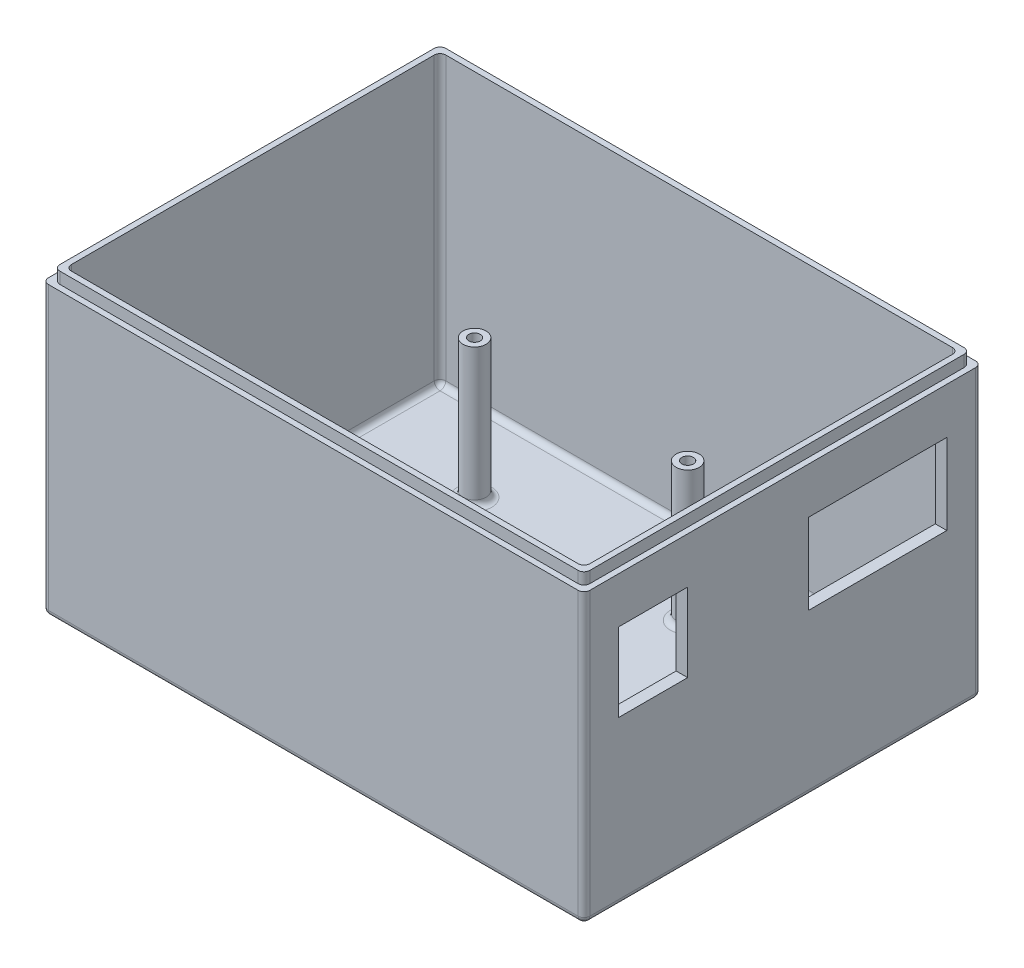
from build123d import *

# Parameters (mm, degrees)
SKETCH1_W            = 90
SKETCH1_H            = 65
BOSS_EXTRUDE1_DEPTH  = 50
SHELL1_T             = 2
SKETCH2_R            = 2.5
BOSS_EXTRUDE2_DEPTH  = 10
SKETCH3_R            = 2.5
SKETCH3_R_2          = 2.67280604
BOSS_EXTRUDE3_DEPTH  = 4
SKETCH5_R            = 1
CUT_EXTRUDE1_DEPTH   = 3
SKETCH7_R            = 2
BOSS_EXTRUDE5_DEPTH  = 24
SKETCH11_R           = 1
CUT_EXTRUDE2_DEPTH   = 4
SKETCH12_W           = 24
SKETCH12_H           = 14
SKETCH12_W_2         = 12
SKETCH12_H_2         = 13.621990599
CUT_EXTRUDE3_DEPTH   = 4
SKETCH13_OUTSIDE_W   = 121.536
SKETCH13_OUTSIDE_H   = 96.536
SKETCH13_OUTSIDE_W_2 = 92
SKETCH13_OUTSIDE_H_2 = 67
CUT_EXTRUDE4_DEPTH   = 2
FILLET1_R            = 1
FILLET2_R            = 1
FILLET3_R            = 1
FILLET4_R            = 1
FILLET5_R            = 1
FILLET6_R            = 1
FILLET7_R            = 1
SKETCH15_R           = 1.25
CUT_EXTRUDE5_DEPTH   = 71.705374619


with BuildPart() as part:
    # Sketch1 → Boss-Extrude1 (new body)
    with BuildSketch(Plane(origin=(0, 0, 0), x_dir=(1, 0, 0), z_dir=(0, 1, 0))):
        Rectangle(SKETCH1_W, SKETCH1_H)
    extrude(amount=BOSS_EXTRUDE1_DEPTH)

    # Shell1
    shell1_openings = [part.faces().sort_by_distance(p)[0] for p in [
        (0, 50, 0),
    ]]
    offset(amount=SHELL1_T, openings=shell1_openings, kind=Kind.INTERSECTION)

    # Sketch2 → Boss-Extrude2 (add)
    with BuildSketch(Plane(origin=(0, 0, 0), x_dir=(1, 0, 0), z_dir=(0, 1, 0))):
        with Locations(Location((40, 0, 0), (0, 0, 270))):
            Circle(SKETCH2_R)
        with Locations(Location((-40, 0, 0), (0, 0, 90))):
            Circle(SKETCH2_R)
    extrude(amount=BOSS_EXTRUDE2_DEPTH)

    # Sketch3 → Boss-Extrude3 (add)
    with BuildSketch(Plane(origin=(0, 0, 0), x_dir=(1, 0, 0), z_dir=(0, 1, 0))):
        with Locations(Location((40, 27.5, 0), (0, 0, 270))):
            Circle(SKETCH3_R)
        with Locations(Location((-40, -27.5, 0), (0, 0, 270))):
            Circle(SKETCH3_R_2)
    extrude(amount=BOSS_EXTRUDE3_DEPTH)

    # Sketch5 → Cut-Extrude1 (cut)
    with BuildSketch(Plane(origin=(0, 4, 0), x_dir=(1, 0, 0), z_dir=(0, 1, 0))):
        with Locations(Location((40, 27.5, 0), (0, 0, 270))):
            Circle(SKETCH5_R)
        with Locations(Location((-40, -27.5, 0), (0, 0, 270))):
            Circle(SKETCH5_R)
    extrude(amount=-CUT_EXTRUDE1_DEPTH, mode=Mode.SUBTRACT)

    # Sketch7 → Boss-Extrude5 (add)
    with BuildSketch(Plane(origin=(0, 0, 0), x_dir=(1, 0, 0), z_dir=(0, 1, 0))):
        with Locations(Location((-25, -18.5, 0), (0, 0, 270))):
            Circle(SKETCH7_R)
        with Locations(Location((-25, 18.5, 0), (0, 0, 90))):
            Circle(SKETCH7_R)
        with Locations(Location((12, 18.5, 0), (0, 0, 270))):
            Circle(SKETCH7_R)
        with Locations(Location((12, -18.5, 0), (0, 0, 90))):
            Circle(SKETCH7_R)
    extrude(amount=BOSS_EXTRUDE5_DEPTH)

    # Sketch11 → Cut-Extrude2 (cut)
    with BuildSketch(Plane(origin=(0, 24, 0), x_dir=(1, 0, 0), z_dir=(0, 1, 0))):
        with Locations(Location((12, 18.5, 0), (0, 0, 270))):
            Circle(SKETCH11_R)
        with Locations(Location((-25, 18.5, 0), (0, 0, 270))):
            Circle(SKETCH11_R)
        with Locations(Location((-25, -18.5, 0), (0, 0, 270))):
            Circle(SKETCH11_R)
        with Locations(Location((12, -18.5, 0), (0, 0, 270))):
            Circle(SKETCH11_R)
    extrude(amount=-CUT_EXTRUDE2_DEPTH, mode=Mode.SUBTRACT)

    # Sketch12 → Cut-Extrude3 (cut)
    with BuildSketch(Plane(origin=(47, 0, 0), x_dir=(0, 0, -1), z_dir=(1, 0, 0))):
        with Locations((16.5, 33)):
            Rectangle(SKETCH12_W, SKETCH12_H)
        with Locations((-22.5, 33.1890047)):
            Rectangle(SKETCH12_W_2, SKETCH12_H_2)
    extrude(amount=-CUT_EXTRUDE3_DEPTH, mode=Mode.SUBTRACT)

    # Sketch13 outside → Cut-Extrude4 (cut)
    with BuildSketch(Plane(origin=(0, 50, 0), x_dir=(1, 0, 0), z_dir=(0, 1, 0))):
        Rectangle(SKETCH13_OUTSIDE_W, SKETCH13_OUTSIDE_H)
        Rectangle(SKETCH13_OUTSIDE_W_2, SKETCH13_OUTSIDE_H_2, mode=Mode.SUBTRACT)
    extrude(amount=-CUT_EXTRUDE4_DEPTH, mode=Mode.SUBTRACT)

    # Fillet1
    fillet1_edges = [part.edges().sort_by_distance(p)[0] for p in [
        (-45, 0, 0),
        (0, 0, 32.5),
        (45, 0, 0),
        (0, 0, -32.5),
    ]]
    fillet(fillet1_edges, radius=FILLET1_R)

    # Fillet2
    # the kernel refuses this fillet: 1 mm, written as the material it adds along each edge
    with BuildSketch(Plane(origin=(44, 1, 31.5), x_dir=(1, 0, 0), z_dir=(0, 0, 1))) as fillet2_piece_1_section:
        Polygon((0, 0), (FILLET2_R, 0), (FILLET2_R, -FILLET2_R), (0, -FILLET2_R), align=None)
    fillet2_piece_1 = extrude(amount=FILLET2_R, mode=Mode.PRIVATE)
    fillet2_piece_1 = fillet2_piece_1 - Plane(origin=(44, 1, 31.5), x_dir=(-0.7071067811865475, 0.7071067811865475, 0), z_dir=(0, 0, 1)) * Sphere(FILLET2_R, mode=Mode.PRIVATE)
    add(fillet2_piece_1)
    with BuildSketch(Plane(origin=(-44, 1, 31.5), x_dir=(-1, 0, 0), z_dir=(0, 0, 1))) as fillet2_piece_2_section:
        Polygon((0, 0), (FILLET2_R, 0), (FILLET2_R, FILLET2_R), (0, FILLET2_R), align=None)
    fillet2_piece_2 = extrude(amount=FILLET2_R, mode=Mode.PRIVATE)
    fillet2_piece_2 = fillet2_piece_2 - Plane(origin=(-44, 1, 31.5), x_dir=(0.7071067811865475, 0.7071067811865475, 0), z_dir=(0, 0, 1)) * Sphere(FILLET2_R, mode=Mode.PRIVATE)
    add(fillet2_piece_2)
    with BuildSketch(Plane(origin=(44, 1, -31.5), x_dir=(0, 0, -1), z_dir=(1, 0, 0))) as fillet2_piece_3_section:
        Polygon((0, 0), (FILLET2_R, 0), (FILLET2_R, -FILLET2_R), (0, -FILLET2_R), align=None)
    fillet2_piece_3 = extrude(amount=FILLET2_R, mode=Mode.PRIVATE)
    fillet2_piece_3 = fillet2_piece_3 - Plane(origin=(44, 1, -31.5), x_dir=(0, 0.7071067811865475, 0.7071067811865475), z_dir=(1, 0, 0)) * Sphere(FILLET2_R, mode=Mode.PRIVATE)
    add(fillet2_piece_3)
    with BuildSketch(Plane(origin=(-44, 1, -31.5), x_dir=(0, 0, -1), z_dir=(-1, 0, 0))) as fillet2_piece_4_section:
        Polygon((0, 0), (FILLET2_R, 0), (FILLET2_R, FILLET2_R), (0, FILLET2_R), align=None)
    fillet2_piece_4 = extrude(amount=FILLET2_R, mode=Mode.PRIVATE)
    fillet2_piece_4 = fillet2_piece_4 - Plane(origin=(-44, 1, -31.5), x_dir=(0, 0.7071067811865475, 0.7071067811865475), z_dir=(-1, 0, 0)) * Sphere(FILLET2_R, mode=Mode.PRIVATE)
    add(fillet2_piece_4)
    with BuildSketch(Plane(origin=(-45, 1, -32.5), x_dir=(0, 0, 1), z_dir=(0, 1, 0)), Plane(origin=(-45, 1, 32.5), x_dir=(1, 0, 0), z_dir=(0, 1, 0))) as fillet2_piece_5:
        with BuildLine():
            CenterArc((FILLET2_R, FILLET2_R), FILLET2_R, 180, 90)
            Line((0, FILLET2_R), (0, 0))
            Line((0, 0), (FILLET2_R, 0))
        make_face()
    extrude(amount=49)
    with BuildSketch(Plane(origin=(45, 1, 32.5), x_dir=(-1, 0, 0), z_dir=(0, 1, 0)), Plane(origin=(45, 1, -32.5), x_dir=(0, 0, 1), z_dir=(0, 1, 0))) as fillet2_piece_6:
        with BuildLine():
            CenterArc((FILLET2_R, -FILLET2_R), FILLET2_R, 90, 90)
            Line((0, -FILLET2_R), (0, 0))
            Line((0, 0), (FILLET2_R, 0))
        make_face()
    extrude(amount=49)

    # Fillet3
    fillet3_edges = [part.edges().sort_by_distance(p)[0] for p in [
        (40, 0, -2.5),
        (-40, 0, 2.5),
        (40, 0, -30),
        (-40, 0, 24.82719396),
        (12, 0, -20.5),
        (-25, 0, 16.5),
        (-25, 0, -16.5),
        (12, 0, 20.5),
    ]]
    fillet(fillet3_edges, radius=FILLET3_R)

    # Fillet4
    fillet4_edges = [part.edges().sort_by_distance(p)[0] for p in [
        (-47, 23, -34.5),
        (47, 23, -34.5),
        (47, 23, 34.5),
        (-47, 23, 34.5),
        (0, -2, -34.5),
        (47, -2, 0),
        (0, -2, 34.5),
        (-47, -2, 0),
    ]]
    fillet(fillet4_edges, radius=FILLET4_R)

    # Fillet5
    fillet5_edges = [part.edges().sort_by_distance(p)[0] for p in [
        (-46, 49, 33.5),
        (-46, 49, -33.5),
        (46, 49, -33.5),
        (46, 49, 33.5),
    ]]
    fillet(fillet5_edges, radius=FILLET5_R)

    # Fillet6
    fillet6_edges = [part.edges().sort_by_distance(p)[0] for p in [
        (12, 20, -19.5),
        (-25, 20, -19.5),
        (-25, 20, 17.5),
        (12, 20, 17.5),
    ]]
    fillet(fillet6_edges, radius=FILLET6_R)

    # Fillet7
    fillet7_edges = [part.edges().sort_by_distance(p)[0] for p in [
        (40, 1, -28.5),
        (-40, 1, 26.5),
    ]]
    fillet(fillet7_edges, radius=FILLET7_R)

    # Sketch15 → Cut-Extrude5 (cut, through all)
    with BuildSketch(Plane(origin=(0, 10, 0), x_dir=(1, 0, 0), z_dir=(0, 1, 0))):
        with Locations(Location((-40, 0, 0), (0, 0, 270))):
            Circle(SKETCH15_R)
        with Locations(Location((40, 0, 0), (0, 0, 270))):
            Circle(SKETCH15_R)
    extrude(amount=-CUT_EXTRUDE5_DEPTH, mode=Mode.SUBTRACT)


solid = part.part
